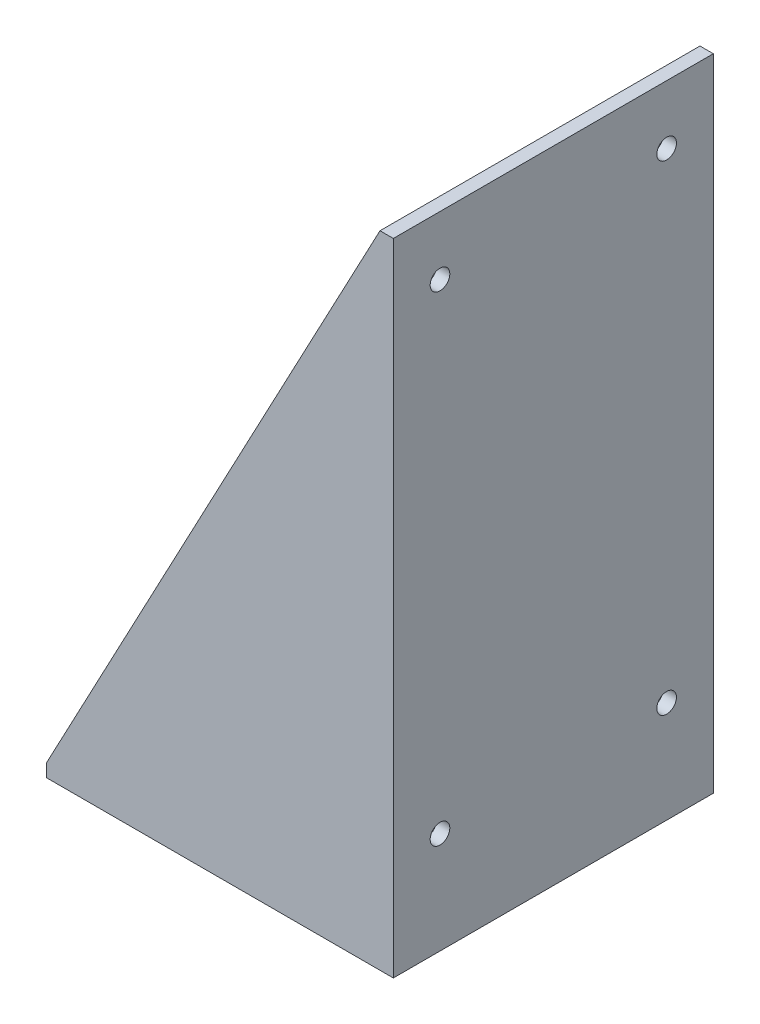
from build123d import *

# Parameters (mm, degrees)
SKETCH1_W           = 82.55
SKETCH1_H           = 76.2
BOSS_EXTRUDE1_DEPTH = 3.175
SKETCH2_W           = 76.2
SKETCH2_H           = 149.352
BOSS_EXTRUDE2_DEPTH = 3.175
SKETCH3_R           = 2.33674158
CUT_EXTRUDE1_DEPTH  = 177.226474661
SKETCH4_R           = 4.365625
CUT_EXTRUDE2_DEPTH  = 162.988353305
BOSS_EXTRUDE3_DEPTH = 2.54
BOSS_EXTRUDE4_DEPTH = 2.54


with BuildPart() as part:
    # Sketch1 → Boss-Extrude1 (new body)
    with BuildSketch(Plane(origin=(0, 0, 0), x_dir=(1, 0, 0), z_dir=(0, 1, 0))):
        with Locations((-8.154876444, 0.512096774)):
            Rectangle(SKETCH1_W, SKETCH1_H)
    extrude(amount=BOSS_EXTRUDE1_DEPTH)

    # Sketch2 → Boss-Extrude2 (add)
    with BuildSketch(Plane(origin=(33.120123556, 0, 0), x_dir=(0, 0, -1), z_dir=(1, 0, 0))):
        with Locations((0.512096774, 77.851)):
            Rectangle(SKETCH2_W, SKETCH2_H)
    extrude(amount=-BOSS_EXTRUDE2_DEPTH)

    # Sketch3 → Cut-Extrude1 (cut, through all)
    with BuildSketch(Plane.ZY.offset(-29.945123556)):
        with Locations((-27.499596774, 24.2062)):
            Circle(SKETCH3_R)
        with Locations((26.475403226, 24.2062)):
            Circle(SKETCH3_R)
        with Locations((-27.499596774, 138.5062)):
            Circle(SKETCH3_R)
        with Locations((26.475403226, 138.5062)):
            Circle(SKETCH3_R)
    extrude(amount=-CUT_EXTRUDE1_DEPTH, mode=Mode.SUBTRACT)

    # Sketch4 → Cut-Extrude2 (cut, through all)
    with BuildSketch(Plane(origin=(0, 3.175, 0), x_dir=(1, 0, 0), z_dir=(0, 1, 0))):
        with Locations((-43.079876444, 25.912096774)):
            Circle(SKETCH4_R)
        with Locations((-17.679876444, 25.912096774)):
            Circle(SKETCH4_R)
        with Locations((-17.679876444, -24.887903226)):
            Circle(SKETCH4_R)
        with Locations((-43.079876444, -24.887903226)):
            Circle(SKETCH4_R)
    extrude(amount=-CUT_EXTRUDE2_DEPTH, mode=Mode.SUBTRACT)

    # Sketch5 → Boss-Extrude3 (add)
    with BuildSketch(Plane.XY.offset(37.587903226)):
        Polygon((-49.429876444, 3.175), (29.945123556, 152.527), (29.945123556, 3.175), align=None)
    extrude(amount=-BOSS_EXTRUDE3_DEPTH)

    # Sketch7 → Boss-Extrude4 (add)
    with BuildSketch(Plane(origin=(0, 0, -38.612096774), x_dir=(-1, 0, 0), z_dir=(0, 0, -1))):
        Polygon((-29.945123556, 152.527), (49.429876444, 3.175), (-29.945123556, 3.175), align=None)
    extrude(amount=-BOSS_EXTRUDE4_DEPTH)


solid = part.part
